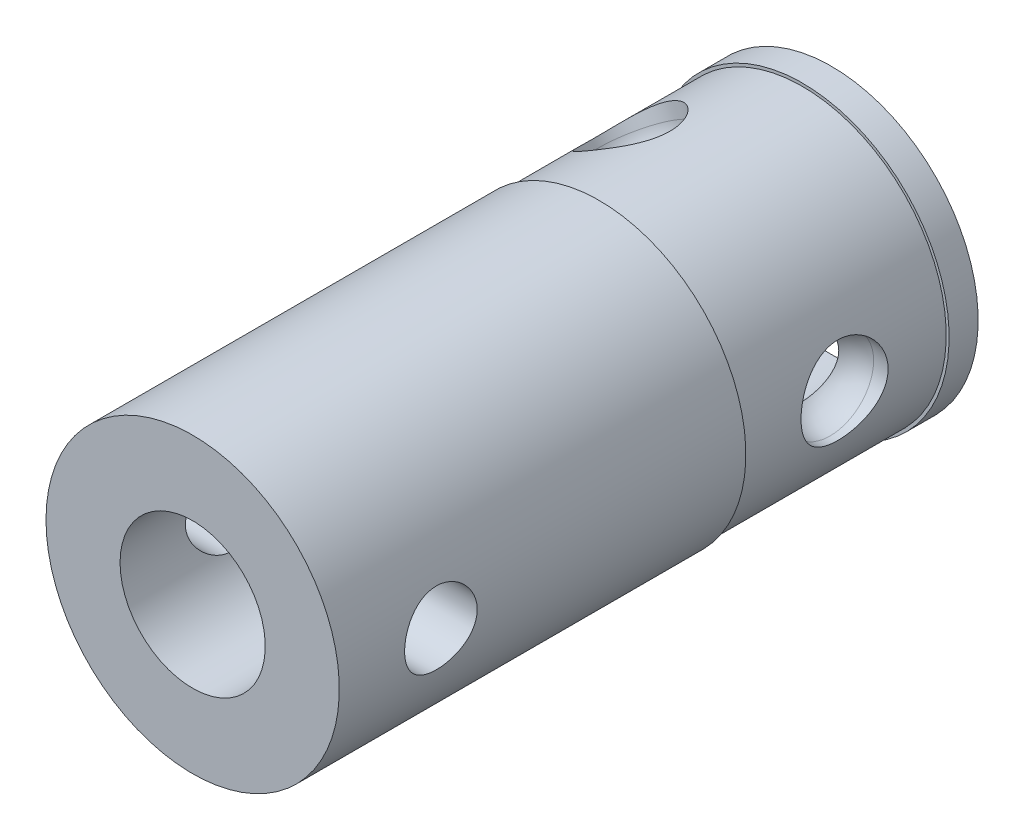
from build123d import *

# Parameters (mm, degrees)
BALL_CUT_PATTERN_COUNT      = 3
M3X0_5_TAPPED_HOLE1_REACH   = 23.674
M3X0_5_TAPPED_HOLE1_BORE_R  = 1.25
SET_SCREW_PATTERN_OUTLINE_W = 1.25
SET_SCREW_PATTERN_OUTLINE_H = 2.885095828


# Read off the part's stored shape, not the designer's step: Set Screw Pattern
with BuildPart() as part:
    # Body Sketch → Body Revolve (revolve)
    with BuildSketch(Plane(origin=(-33.219700818, 0, -2.434260963), x_dir=(-1, 0, 0), z_dir=(0, 1, 0)), mode=Mode.PRIVATE) as body_revolve_sk:
        Polygon((-35.719700818, 24.434260963), (-38.269700818, 24.434260963), (-38.269700818, 10.434260963), (-38.169700818, 10.434260963), (-38.169700818, 3.434260963), (-38.269700818, 3.434260963), (-38.269700818, 2.434260963), (-36.769700818, 2.434260963), (-36.769700818, 9.184260963), (-35.719700818, 9.184260963), align=None)
    revolve(body_revolve_sk.sketch.rotate(Axis((0, 0, 0), (0, 0, 1)), 180), axis=Axis((0, 0, 0), (0, 0, 1)))

    # Ball Cut Out Sketch → Ball Cut Revolve (revolve, cut)
    with BuildSketch(Plane(origin=(0, 0, 0), x_dir=(1, 0, 0), z_dir=(0, 1, 0)), mode=Mode.PRIVATE) as ball_cut_revolve_sk:
        with BuildLine():
            Line((4.45, -6), (9.45, -6))
            Line((9.45, -6), (9.45, -4.5))
            Line((9.45, -4.5), (2.95, -4.5))
            ThreePointArc((2.95, -4.5), (3.389339828, -5.560660172), (4.45, -6))
        make_face()
    ball_cut_revolve = revolve(ball_cut_revolve_sk.sketch.rotate(Axis((9.45, 0, 4.5), (-1, 0, 0)), 180), axis=Axis((9.45, 0, 4.5), (-1, 0, 0)), mode=Mode.SUBTRACT)

    # Ball Cut Pattern: Ball Cut Revolve ×3 about axis
    ball_cut_pattern_axis = Axis((0, 0, 0), (0, 0, 1))
    for i in range(1, BALL_CUT_PATTERN_COUNT):
        add(ball_cut_revolve.rotate(ball_cut_pattern_axis, i * 360 / BALL_CUT_PATTERN_COUNT), mode=Mode.SUBTRACT)

    # M3x0.5 Tapped Hole1 bore (on position points) → M3x0.5 Tapped Hole1 (cut, up to next)
    with BuildSketch(Plane(origin=(5.05, 0, 18.5), x_dir=(0, 1, 0), z_dir=(1, 0, 0)), mode=Mode.PRIVATE) as m3x0_5_tapped_hole1_sk1:
        Circle(M3X0_5_TAPPED_HOLE1_BORE_R)
    m3x0_5_tapped_hole1_tool1 = extrude(m3x0_5_tapped_hole1_sk1.sketch, amount=-M3X0_5_TAPPED_HOLE1_REACH, mode=Mode.PRIVATE) & part.part
    add(m3x0_5_tapped_hole1_tool1.solids().sort_by_distance((5.05, 0, 18.5))[0], mode=Mode.SUBTRACT)

    # Set Screw Pattern outline → Set Screw Pattern (revolve, cut)
    with BuildSketch(Plane.YX.offset(-18.5)):
        with Locations((0.625, -3.607452342)):
            Rectangle(SET_SCREW_PATTERN_OUTLINE_W, SET_SCREW_PATTERN_OUTLINE_H)
    revolve(axis=Axis((0, 0, 18.5), (1, 0, 0)), mode=Mode.SUBTRACT)


solid = part.part
